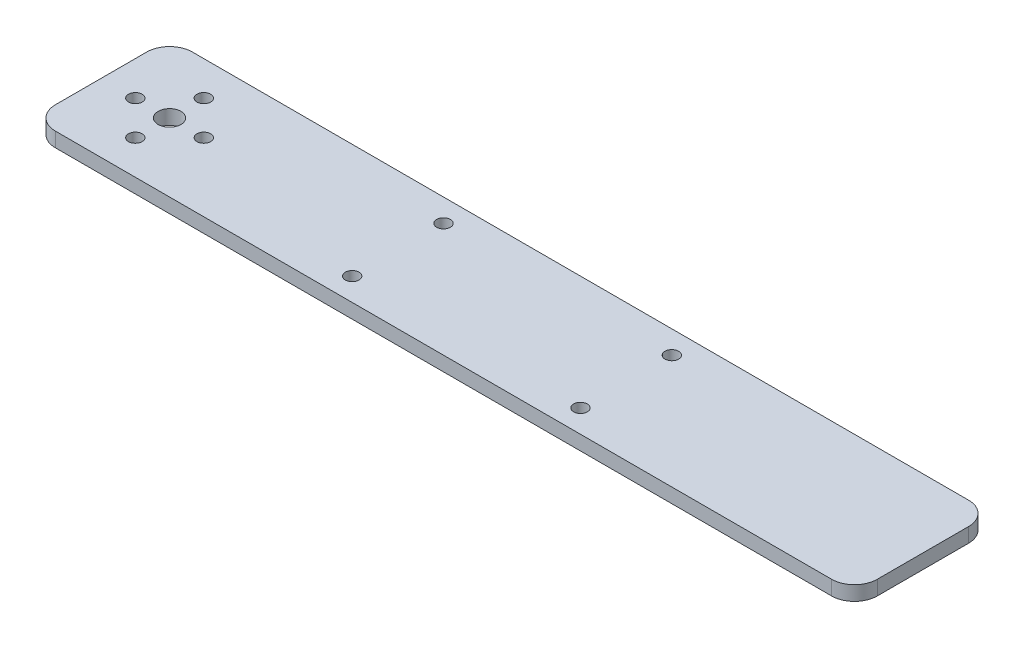
from build123d import *

# Parameters (mm, degrees)
SKETCH1_W           = 180
SKETCH1_H           = 30
BOSS_EXTRUDE1_DEPTH = 3.175
FILLET1_R           = 5
SKETCH2_R           = 2.5
CUT_EXTRUDE1_DEPTH  = 166.710834362
SKETCH3_R           = 1.5
CUT_EXTRUDE3_DEPTH  = 166.710834362
SKETCH4_R           = 1.5
CUT_EXTRUDE4_DEPTH  = 10


with BuildPart() as part:
    # Sketch1 → Boss-Extrude1 (new body)
    with BuildSketch(Plane(origin=(0, 0, 0), x_dir=(1, 0, 0), z_dir=(0, 1, 0))):
        with Locations((75, 0)):
            Rectangle(SKETCH1_W, SKETCH1_H)
    extrude(amount=BOSS_EXTRUDE1_DEPTH)

    # Fillet1
    fillet1_edges = [part.edges().sort_by_distance(p)[0] for p in [
        (165, 1.5875, 15),
        (165, 1.5875, -15),
        (-15, 1.5875, -15),
        (-15, 1.5875, 15),
    ]]
    fillet(fillet1_edges, radius=FILLET1_R)

    # Sketch2 → Cut-Extrude1 (cut, through all)
    with BuildSketch(Plane(origin=(0, 3.175, 0), x_dir=(1, 0, 0), z_dir=(0, 1, 0))):
        Circle(SKETCH2_R)
    extrude(amount=-CUT_EXTRUDE1_DEPTH, mode=Mode.SUBTRACT)

    # Sketch3 → Cut-Extrude3 (cut, through all)
    with BuildSketch(Plane(origin=(0, 3.175, 0), x_dir=(1, 0, 0), z_dir=(0, 1, 0))):
        with Locations((7.5, 0)):
            Circle(SKETCH3_R)
        with Locations((0, -7.5)):
            Circle(SKETCH3_R)
        with Locations((-7.5, 0)):
            Circle(SKETCH3_R)
        with Locations((0, 7.5)):
            Circle(SKETCH3_R)
    extrude(amount=-CUT_EXTRUDE3_DEPTH, mode=Mode.SUBTRACT)

    # Sketch4 → Cut-Extrude4 (cut)
    with BuildSketch(Plane(origin=(0, 3.175, 0), x_dir=(1, 0, 0), z_dir=(0, 1, 0))):
        with Locations((50, -10)):
            Circle(SKETCH4_R)
        with Locations((100, -10)):
            Circle(SKETCH4_R)
        with Locations((100, 10)):
            Circle(SKETCH4_R)
        with Locations((50, 10)):
            Circle(SKETCH4_R)
    extrude(amount=-CUT_EXTRUDE4_DEPTH, mode=Mode.SUBTRACT)


solid = part.part
